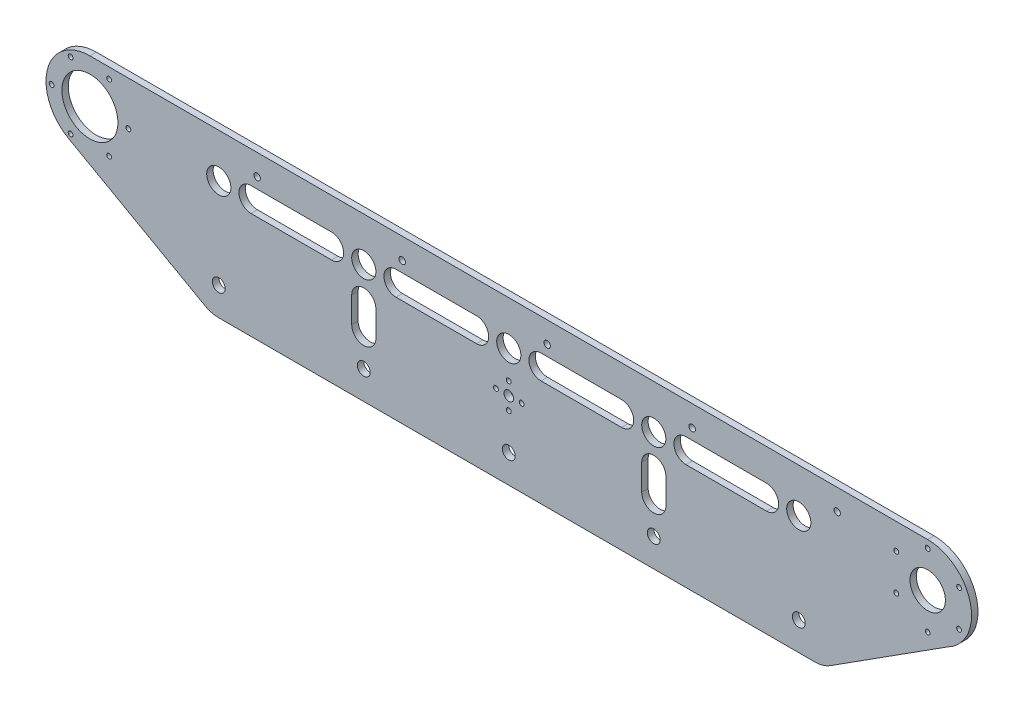
from build123d import *

# Parameters (mm, degrees)
CROQUIS1_R              = 4
CROQUIS1_R_2            = 7.5
CROQUIS1_R_3            = 17.4
CROQUIS1_R_4            = 11
CROQUIS1_R_5            = 1.5
CROQUIS1_R_6            = 3
SALIENTE_EXTRUIR1_DEPTH = 2
CROQUIS2_R              = 1.5
CORTAR_EXTRUIR1_DEPTH   = 10
CROQUIS3_R              = 1.5
CORTAR_EXTRUIR2_DEPTH   = 10
CROQUIS4_R              = 2
CORTAR_EXTRUIR3_DEPTH   = 10


with BuildPart() as part:
    # Croquis1 → Saliente-Extruir1 (new, symmetric)
    with BuildSketch(Plane.XY):
        with BuildLine():
            Line((-179.195612521, -41.480204958), (179.195612521, -41.480204958))
            Line((179.195612521, -41.480204958), (190.010789857, -41.480204958))
            ThreePointArc((190.010789857, -41.480204958), (194.944809403, -40.774865591), (199.483580997, -38.715349889))
            Line((199.483580997, -38.715349889), (272.742664287, 8.031785175))
            ThreePointArc((272.742664287, 8.031785175), (286.437106864, 38.672371901), (260, 59.347542834))
            Line((260, 59.347542834), (-260, 59.347542834))
            ThreePointArc((-260, 59.347542834), (-286.437106864, 38.672371901), (-272.742664287, 8.031785175))
            Line((-272.742664287, 8.031785175), (-188.625622076, -39.240895373))
            ThreePointArc((-188.625622076, -39.240895373), (-184.06774563, -41.022236998), (-179.195612521, -41.480204958))
        make_face()
        with Locations((0, -23.892457166)):
            Circle(CROQUIS1_R, mode=Mode.SUBTRACT)
        with Locations((-90, -23.892457166)):
            Circle(CROQUIS1_R, mode=Mode.SUBTRACT)
        with Locations((-180, -23.892457166)):
            Circle(CROQUIS1_R, mode=Mode.SUBTRACT)
        with Locations((-90, 32.107542834)):
            Circle(CROQUIS1_R_2, mode=Mode.SUBTRACT)
        with Locations((0, 32.107542834)):
            Circle(CROQUIS1_R_2, mode=Mode.SUBTRACT)
        with Locations((-260, 32.107542834)):
            Circle(CROQUIS1_R_3, mode=Mode.SUBTRACT)
        with Locations((260, 32.107542834)):
            Circle(CROQUIS1_R_4, mode=Mode.SUBTRACT)
        with Locations((90, 32.107542834)):
            Circle(CROQUIS1_R_2, mode=Mode.SUBTRACT)
        with Locations((90, -23.892457166)):
            Circle(CROQUIS1_R, mode=Mode.SUBTRACT)
        with Locations((-180, 32.107542834)):
            Circle(CROQUIS1_R_2, mode=Mode.SUBTRACT)
        with Locations((180, 32.107542834)):
            Circle(CROQUIS1_R_2, mode=Mode.SUBTRACT)
        with Locations((-8, 6.607542834)):
            Circle(CROQUIS1_R_5, mode=Mode.SUBTRACT)
        with Locations((0, 14.607542834)):
            Circle(CROQUIS1_R_5, mode=Mode.SUBTRACT)
        with Locations((8, 6.607542834)):
            Circle(CROQUIS1_R_5, mode=Mode.SUBTRACT)
        with Locations((0, -1.392457166)):
            Circle(CROQUIS1_R_5, mode=Mode.SUBTRACT)
        with Locations((0, 6.607542834)):
            Circle(CROQUIS1_R_6, mode=Mode.SUBTRACT)
        with Locations((180, -23.892457166)):
            Circle(CROQUIS1_R, mode=Mode.SUBTRACT)
        with BuildLine():
            Line((-82.5, 12.107542834), (-82.5, -3.892457166))
            ThreePointArc((-82.5, -3.892457166), (-90, -11.392457166), (-97.5, -3.892457166))
            Line((-97.5, -3.892457166), (-97.5, 12.107542834))
            ThreePointArc((-97.5, 12.107542834), (-90, 19.607542834), (-82.5, 12.107542834))
        make_face(mode=Mode.SUBTRACT)
        with BuildLine():
            Line((-20, 24.607542834), (-70, 24.607542834))
            ThreePointArc((-70, 24.607542834), (-77.5, 32.107542834), (-70, 39.607542834))
            Line((-70, 39.607542834), (-20, 39.607542834))
            ThreePointArc((-20, 39.607542834), (-12.5, 32.107542834), (-20, 24.607542834))
        make_face(mode=Mode.SUBTRACT)
        with BuildLine():
            Line((20, 39.607542834), (70, 39.607542834))
            ThreePointArc((70, 39.607542834), (77.5, 32.107542834), (70, 24.607542834))
            Line((70, 24.607542834), (20, 24.607542834))
            ThreePointArc((20, 24.607542834), (12.5, 32.107542834), (20, 39.607542834))
        make_face(mode=Mode.SUBTRACT)
        with BuildLine():
            Line((-160, 39.607542834), (-110, 39.607542834))
            ThreePointArc((-110, 39.607542834), (-102.5, 32.107542834), (-110, 24.607542834))
            Line((-110, 24.607542834), (-160, 24.607542834))
            ThreePointArc((-160, 24.607542834), (-167.5, 32.107542834), (-160, 39.607542834))
        make_face(mode=Mode.SUBTRACT)
        with BuildLine():
            Line((160, 24.607542834), (110, 24.607542834))
            ThreePointArc((110, 24.607542834), (102.5, 32.107542834), (110, 39.607542834))
            Line((110, 39.607542834), (160, 39.607542834))
            ThreePointArc((160, 39.607542834), (167.5, 32.107542834), (160, 24.607542834))
        make_face(mode=Mode.SUBTRACT)
        with BuildLine():
            Line((97.5, 12.107542834), (97.5, -3.892457166))
            ThreePointArc((97.5, -3.892457166), (90, -11.392457166), (82.5, -3.892457166))
            Line((82.5, -3.892457166), (82.5, 12.107542834))
            ThreePointArc((82.5, 12.107542834), (90, 19.607542834), (97.5, 12.107542834))
        make_face(mode=Mode.SUBTRACT)
    extrude(amount=SALIENTE_EXTRUIR1_DEPTH, both=True)

    # Croquis2 → Cortar-Extruir1 (cut)
    with BuildSketch(Plane.XY.offset(2)):
        with Locations((-283.74, 32.107542834)):
            Circle(CROQUIS2_R)
        with Locations((-271.95, 52.805549985)):
            Circle(CROQUIS2_R)
        with Locations((-248.05, 52.805549985)):
            Circle(CROQUIS2_R)
        with Locations((-236.1, 32.107542834)):
            Circle(CROQUIS2_R)
        with Locations((-248.05, 11.409535684)):
            Circle(CROQUIS2_R)
        with Locations((-271.95, 11.409535684)):
            Circle(CROQUIS2_R)
    extrude(amount=-CORTAR_EXTRUIR1_DEPTH, mode=Mode.SUBTRACT)

    # Croquis3 → Cortar-Extruir2 (cut)
    with BuildSketch(Plane.XY.offset(2)):
        with Locations((260, 54.607542834)):
            Circle(CROQUIS3_R)
        with Locations((279.485571585, 43.357542834)):
            Circle(CROQUIS3_R)
        with Locations((279.485571585, 20.857542834)):
            Circle(CROQUIS3_R)
        with Locations((260, 9.607542834)):
            Circle(CROQUIS3_R)
        with Locations((240.514428415, 20.857542834)):
            Circle(CROQUIS3_R)
        with Locations((240.514428415, 43.357542834)):
            Circle(CROQUIS3_R)
    extrude(amount=-CORTAR_EXTRUIR2_DEPTH, mode=Mode.SUBTRACT)

    # Croquis4 → Cortar-Extruir3 (cut)
    with BuildSketch(Plane.XY.offset(2)):
        with Locations((-156.165571585, 46.217542834)):
            Circle(CROQUIS4_R)
        with Locations((-66.165571585, 46.217542834)):
            Circle(CROQUIS4_R)
        with Locations((23.834428415, 46.217542834)):
            Circle(CROQUIS4_R)
        with Locations((113.834428415, 46.217542834)):
            Circle(CROQUIS4_R)
        with Locations((203.834428415, 46.217542834)):
            Circle(CROQUIS4_R)
    extrude(amount=-CORTAR_EXTRUIR3_DEPTH, mode=Mode.SUBTRACT)


solid = part.part
